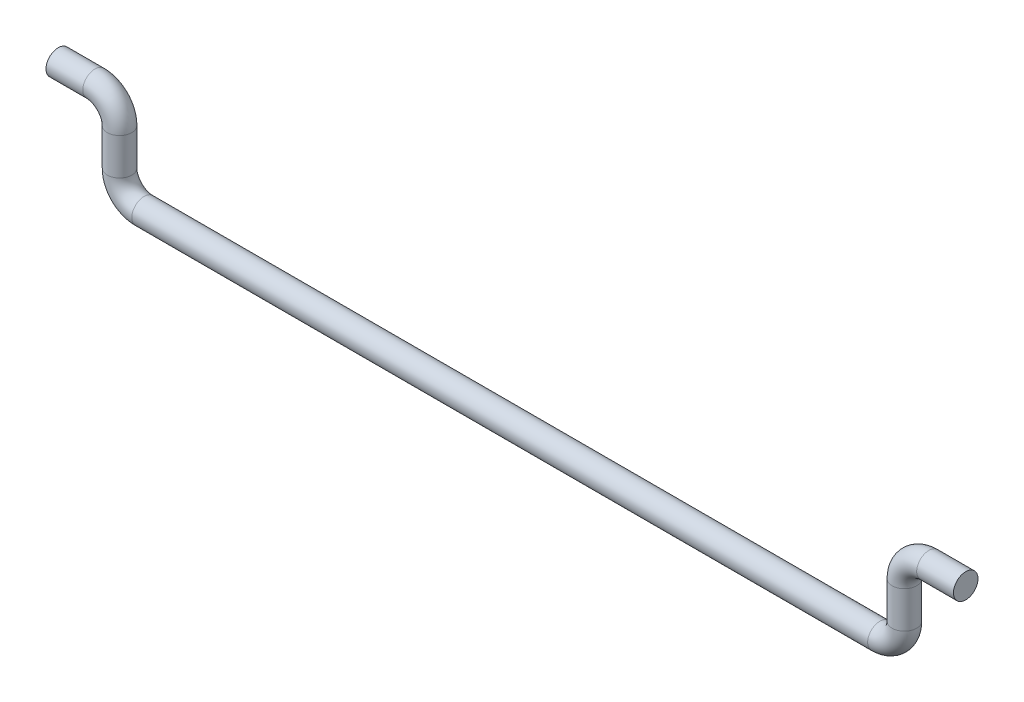
from build123d import *

# Parameters (mm, degrees)
SKETCH3_R = 1


with BuildPart() as part:
    # Sweep2: sweep along a path in Sketch1
    with BuildLine(Plane.XY) as sweep2_path:
        Line((-67, 7), (-64, 7))
        ThreePointArc((-64, 7), (-62.585786438, 6.414213562), (-62, 5))
        Line((-62, 5), (-62, 2))
        ThreePointArc((-62, 2), (-61.414213562, 0.585786438), (-60, 0))
        Line((-60, 0), (0, 0))
        ThreePointArc((0, 0), (1.414213562, 0.585786438), (2, 2))
        Line((2, 2), (2, 5))
        ThreePointArc((2, 5), (2.585786438, 6.414213562), (4, 7))
        Line((4, 7), (7, 7))
    # Sketch3 → Sweep2 (sweep)
    with BuildSketch(Plane(origin=(7, 0, 0), x_dir=(0, 0, -1), z_dir=(1, 0, 0))):
        with Locations((0.430401407, 7)):
            Circle(SKETCH3_R)
    sweep(path=sweep2_path.line)


solid = part.part
